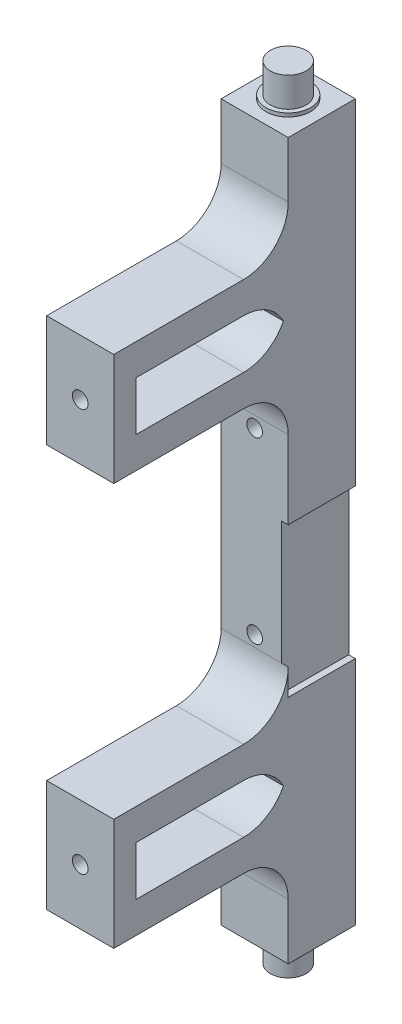
from build123d import *

# Parameters (mm, degrees)
ESQUISSE1_W                      = 25
ESQUISSE1_H                      = 15
BOSS_EXTRU_1_DEPTH               = 39
BOSS_EXTRU_1_2_DEPTH             = 39
ESQUISSE3_W                      = 160
ESQUISSE3_H                      = 15
BOSS_EXTRU_2_DEPTH               = 15
ESQUISSE4_R                      = 5
ESQUISSE4_R_2                    = 4
BOSS_EXTRU_5_DEPTH               = 0.8
ESQUISSE4_6_R                    = 4
BOSS_EXTRU_6_DEPTH               = 7.4
CONG_1_R                         = 10
ESQUISSE5_W                      = 11
ESQUISSE5_H                      = 34
ENL_V_MAT_EXTRU_1_DEPTH          = 97.874970968
CONG_2_R                         = 10
ESQUISSE6_R                      = 1.75
ENL_V_MAT_EXTRU_2_DEPTH          = 101.478903258
ESQUISSE11_R                     = 1.75
TROUS_VIS_SUPPORT_CAPTEURS_DEPTH = 97.000052083
ESQUISSE12_W                     = 33.4
ESQUISSE12_H                     = 4.7
ENCOCHE_CARTE_CAPTEUR_DEPTH      = 97.000052083


with BuildPart() as part:
    # Esquisse1 → Boss.-Extru.1 (new body)
    with BuildSketch(Plane(origin=(0, 0, 0), x_dir=(0, 1, 0), z_dir=(0, 0, 1))):
        with Locations((-45, 0)):
            Rectangle(ESQUISSE1_W, ESQUISSE1_H)
    extrude(amount=BOSS_EXTRU_1_DEPTH)



with BuildPart() as body_2:
    # Esquisse1 → Boss.-Extru.1 2 (new body)
    with BuildSketch(Plane(origin=(0, 0, 0), x_dir=(0, 1, 0), z_dir=(0, 0, 1))):
        with Locations((45, 0)):
            Rectangle(ESQUISSE1_W, ESQUISSE1_H)
    extrude(amount=BOSS_EXTRU_1_2_DEPTH)


with BuildPart() as part_1:
    add(part.part)

    add(body_2.part)  # Boss.-Extru.2 merges body 2
    # Esquisse3 → Boss.-Extru.2 (add)
    with BuildSketch(Plane(origin=(0, 0, 0), x_dir=(0, 1, 0), z_dir=(0, 0, 1))):
        Rectangle(ESQUISSE3_W, ESQUISSE3_H)
    extrude(amount=-BOSS_EXTRU_2_DEPTH)

    # Esquisse4 → Boss.-Extru.5 (add)
    with BuildSketch(Plane(origin=(0, -80, 0), x_dir=(-1, 0, 0), z_dir=(0, -1, 0))):
        with Locations(Location((0, 7.5, 0), (0, 0, 90))):
            Circle(ESQUISSE4_R)
        with Locations(Location((0, 7.5, 0), (0, 0, 90))):
            Circle(ESQUISSE4_R_2, mode=Mode.SUBTRACT)
    boss_extru_5 = extrude(amount=BOSS_EXTRU_5_DEPTH)

    # Esquisse4<6> → Boss.-Extru.6 (add)
    with BuildSketch(Plane(origin=(0, -80, 0), x_dir=(-1, 0, 0), z_dir=(0, -1, 0))):
        with Locations(Location((0, 7.5, 0), (0, 0, 90))):
            Circle(ESQUISSE4_6_R)
    boss_extru_6 = extrude(amount=BOSS_EXTRU_6_DEPTH)

    # Symétrie2: Boss.-Extru.5, Boss.-Extru.6 across plane
    add(boss_extru_5.mirror(Plane.ZX))
    add(boss_extru_6.mirror(Plane.ZX))

    # Congé1
    cong_1_edges = [part_1.edges().sort_by_distance(p)[0] for p in [
        (0, 57.5, 0),
        (0, 32.5, 0),
        (0, -57.5, 0),
        (0, -32.5, 0),
    ]]
    fillet(cong_1_edges, radius=CONG_1_R)

    # Esquisse5 → Enlèv. mat.-Extru.1 (cut, through all)
    with BuildSketch(Plane(origin=(-7.5, 0, 0), x_dir=(0, -1, 0), z_dir=(-1, 0, 0))):
        with Locations((45, 17)):
            Rectangle(ESQUISSE5_W, ESQUISSE5_H)
        with Locations((-45, 17)):
            Rectangle(ESQUISSE5_W, ESQUISSE5_H)
    extrude(amount=-ENL_V_MAT_EXTRU_1_DEPTH, mode=Mode.SUBTRACT)

    # Congé2
    # the kernel refuses this fillet: 10 mm, written as the material it adds along each edge
    with BuildSketch(Plane(origin=(-7.5, 39.5, 0), x_dir=(0, 0, 1), z_dir=(1, 0, 0)), Plane(origin=(-7.5, -39.5, 0), x_dir=(0, -1, 0), z_dir=(1, 0, 0)), Plane(origin=(-7.5, -50.5, 0), x_dir=(0, 0, 1), z_dir=(1, 0, 0))) as cong_2_piece_1:
        with BuildLine():
            CenterArc((CONG_2_R, -CONG_2_R), CONG_2_R, 90, 90)
            Line((0, -CONG_2_R), (0, 0))
            Line((0, 0), (CONG_2_R, 0))
        make_face()
    extrude(amount=15)
    with BuildSketch(Plane(origin=(-7.5, 50.5, 0), x_dir=(0, 0, 1), z_dir=(1, 0, 0))) as cong_2_piece_2:
        with BuildLine():
            CenterArc((CONG_2_R, CONG_2_R), CONG_2_R, 180, 90)
            Line((0, CONG_2_R), (0, 0))
            Line((0, 0), (CONG_2_R, 0))
        make_face()
    extrude(amount=15)

    # Esquisse6 → Enlèv. mat.-Extru.2 (cut, through all)
    with BuildSketch(Plane(origin=(0, 0, 34), x_dir=(1, 0, 0), z_dir=(0, 0, -1))):
        with Locations(Location((0, 45, 0), (0, 0, 180))):
            Circle(ESQUISSE6_R)
        with Locations((0, -45)):
            Circle(ESQUISSE6_R)
    extrude(amount=-ENL_V_MAT_EXTRU_2_DEPTH, mode=Mode.SUBTRACT)

    # Esquisse11 → Trous vis support capteurs (cut, through all)
    with BuildSketch(Plane(origin=(0, 0, 0), x_dir=(0, 1, 0), z_dir=(0, 0, 1))):
        with Locations(Location((20, 0, 0), (0, 0, 270))):
            Circle(ESQUISSE11_R)
        with Locations(Location((-20, 0, 0), (0, 0, 270))):
            Circle(ESQUISSE11_R)
    extrude(amount=-TROUS_VIS_SUPPORT_CAPTEURS_DEPTH, mode=Mode.SUBTRACT)

    # Esquisse12 → Encoche carte capteur (cut, through all)
    with BuildSketch(Plane(origin=(0, 0, 0), x_dir=(0, 1, 0), z_dir=(0, 0, 1))):
        with Locations((-11.675958981, -8.388484641)):
            Rectangle(ESQUISSE12_W, ESQUISSE12_H)
    extrude(amount=-ENCOCHE_CARTE_CAPTEUR_DEPTH, mode=Mode.SUBTRACT)


solid = part_1.part
